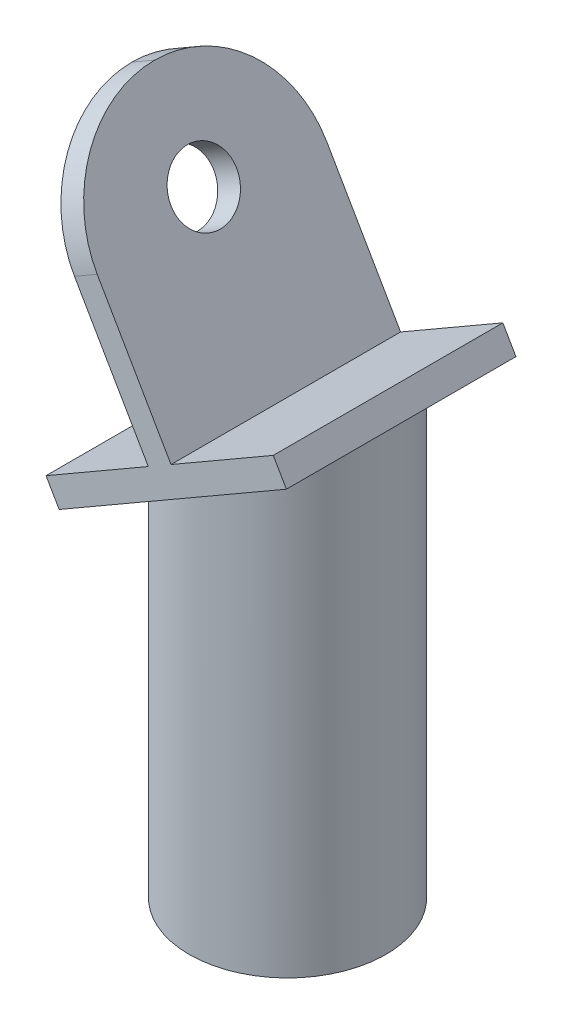
from build123d import *

# Parameters (mm, degrees)
SKETCH2_R               = 15
SKETCH2_R_2             = 13
BOSS_EXTRUDE1_DEPTH     = 70
CUT_EXTRUDE1_DEPTH      = 74.143694192
CUT_EXTRUDE1_DEPTH_BACK = 74.143694192
SKETCH4_W               = 40
SKETCH4_H               = 35
BOSS_EXTRUDE2_DEPTH     = 4
SKETCH5_W               = 4
SKETCH5_H               = 35
BOSS_EXTRUDE4_DEPTH     = 40
SKETCH6_R               = 5
CUT_EXTRUDE2_DEPTH      = 101.39586407
FILLET3_R               = 17.5


with BuildPart() as part:
    # Sketch2 → Boss-Extrude1 (new body)
    with BuildSketch(Plane(origin=(0, 0, 0), x_dir=(1, 0, 0), z_dir=(0, 1, 0))):
        with Locations(Location((0, 0, 0), (0, 0, 270))):
            Circle(SKETCH2_R)
        with Locations(Location((0, 0, 0), (0, 0, 270))):
            Circle(SKETCH2_R_2, mode=Mode.SUBTRACT)
    extrude(amount=BOSS_EXTRUDE1_DEPTH)

    # Sketch3 → Cut-Extrude1 (cut, two sides: drawn at the far end of the back side and taken through both)
    with BuildSketch(Plane.XY.offset(-CUT_EXTRUDE1_DEPTH_BACK)):
        Polygon((-15, 52.679491924), (-15, 70), (15, 70), align=None)
    extrude(amount=CUT_EXTRUDE1_DEPTH + CUT_EXTRUDE1_DEPTH_BACK, mode=Mode.SUBTRACT)

    # Sketch4 → Boss-Extrude2 (add)
    with BuildSketch(Plane(origin=(-26.560889132, 46.004809472, 0), x_dir=(0.866025403784438, 0.5000000000000012, 0), z_dir=(-0.5000000000000012, 0.866025403784438, 0))):
        with Locations((30.669872981, 0)):
            Rectangle(SKETCH4_W, SKETCH4_H)
    extrude(amount=BOSS_EXTRUDE2_DEPTH)

    # Sketch5 → Boss-Extrude4 (add)
    with BuildSketch(Plane(origin=(-28.560889132, 49.468911087, 0), x_dir=(0.866025403784438, 0.5000000000000012, 0), z_dir=(-0.5000000000000011, 0.8660254037844379, 0))):
        with Locations((30.669872981, 0)):
            Rectangle(SKETCH5_W, SKETCH5_H)
    extrude(amount=BOSS_EXTRUDE4_DEPTH)

    # Sketch6 → Cut-Extrude2 (cut, through all)
    with BuildSketch(Plane(origin=(24.828838325, 14.334936491, 0), x_dir=(0, 0, 1), z_dir=(-0.8660254037844382, -0.5000000000000011, 0))):
        with Locations(Location((0, 82.121778265, 0), (0, 0, 270))):
            Circle(SKETCH6_R)
    extrude(amount=-CUT_EXTRUDE2_DEPTH, mode=Mode.SUBTRACT)

    # Fillet3
    fillet3_edges = [part.edges().sort_by_distance(p)[0] for p in [
        (-22, 99.444863729, 17.5),
        (-22, 99.444863729, -17.5),
    ]]
    fillet(fillet3_edges, radius=FILLET3_R - 0.0001)  # a hair under: the kernel refuses the full size


solid = part.part
